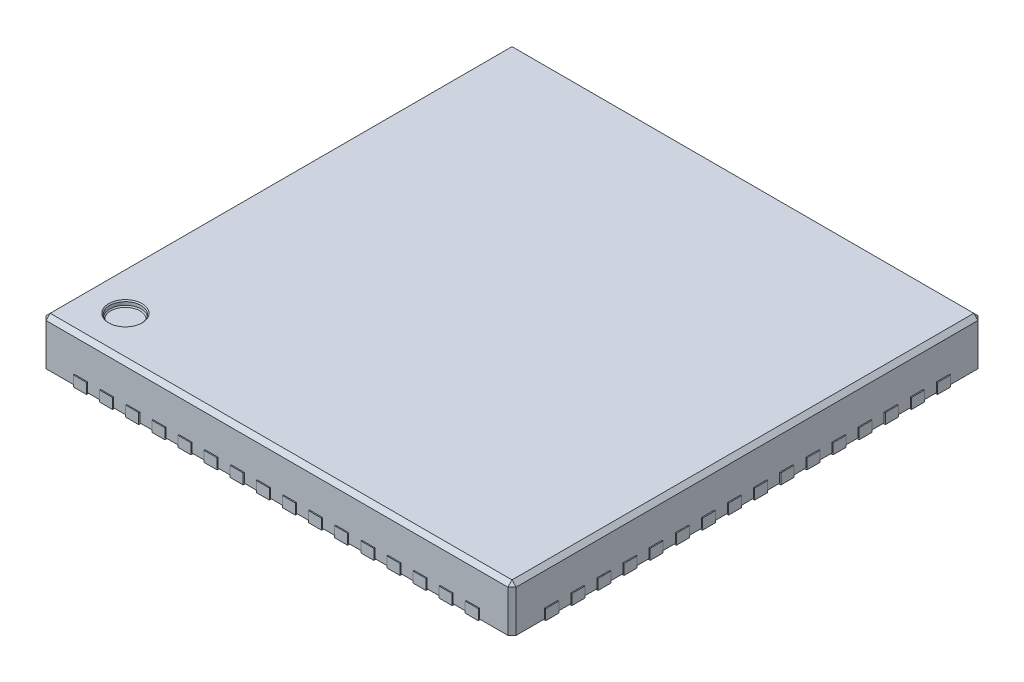
from build123d import *

# Parameters (mm, degrees)
BOSS_EXTRUDE1_DEPTH = 0.88
CHAMFER1_SIZE       = 0.08
SKETCH2_R           = 0.3
CUT_EXTRUDE1_DEPTH  = 0.1
CHAMFER2_SIZE       = 0.02
BOSS_EXTRUDE2_DEPTH = 0.2
LPATTERN1_COUNT     = 8
LPATTERN1_PITCH     = 0.5
LPATTERN2_COUNT     = 9
LPATTERN2_PITCH     = 0.5
CIRPATTERN2_COUNT   = 4
BOSS_EXTRUDE3_DEPTH = 0.2


with BuildPart() as part:
    # 3DSketch1 → Boss-Extrude1 (new body)
    with BuildSketch(Plane(origin=(-4.5, 0.02, 4.5), x_dir=(0.7071067811865474, 0, -0.7071067811865477), z_dir=(0, 1, 0))):
        Polygon((0, 0), (6.363961031, -6.363961031), (12.727922061, 0), (6.363961031, 6.363961031), align=None)
    extrude(amount=BOSS_EXTRUDE1_DEPTH)

    # Chamfer1
    chamfer1_edges = [part.edges().sort_by_distance(p)[0] for p in [
        (-4.5, 0.9, 0),
        (-4.5, 0.46, -4.5),
        (0, 0.9, -4.5),
        (4.5, 0.46, -4.5),
        (4.5, 0.9, 0),
        (-4.5, 0.46, 4.5),
        (0, 0.9, 4.5),
        (4.5, 0.46, 4.5),
    ]]
    chamfer(chamfer1_edges, length=CHAMFER1_SIZE)

    # Sketch2 → Cut-Extrude1 (cut)
    with BuildSketch(Plane(origin=(0, 0.9, 0), x_dir=(1, 0, 0), z_dir=(0, 1, 0))):
        with Locations((-3.7, -3.7)):
            Circle(SKETCH2_R)
    extrude(amount=-CUT_EXTRUDE1_DEPTH, mode=Mode.SUBTRACT)

    # Chamfer2
    chamfer2_edges = [part.edges().sort_by_distance(p)[0] for p in [
        (-4, 0.9, 3.7),
        (-4, 0.8, 3.7),
    ]]
    chamfer(chamfer2_edges, length=CHAMFER2_SIZE)


with BuildPart() as body_2:
    # Sketch3 → Boss-Extrude2 (new body)
    with BuildSketch(Plane(origin=(0, 0, 0), x_dir=(1, 0, 0), z_dir=(0, 1, 0))):
        with BuildLine():
            Line((0.375, 4.52), (0.125, 4.52))
            Line((0.125, 4.52), (0.125, 4.225))
            ThreePointArc((0.125, 4.225), (0.25, 4.1), (0.375, 4.225))
            Line((0.375, 4.225), (0.375, 4.52))
        make_face()
    extrude(amount=BOSS_EXTRUDE2_DEPTH)


with BuildPart() as lpattern1_1:
    # LPattern1: pattern copy
    add(body_2.part.moved(Location(Vector(1, 0, 0) * (1 * LPATTERN1_PITCH))))


with BuildPart() as lpattern1_2:
    # LPattern1: pattern copy
    add(body_2.part.moved(Location(Vector(1, 0, 0) * (2 * LPATTERN1_PITCH))))


with BuildPart() as lpattern1_3:
    # LPattern1: pattern copy
    add(body_2.part.moved(Location(Vector(1, 0, 0) * (3 * LPATTERN1_PITCH))))


with BuildPart() as lpattern1_4:
    # LPattern1: pattern copy
    add(body_2.part.moved(Location(Vector(1, 0, 0) * (4 * LPATTERN1_PITCH))))


with BuildPart() as lpattern1_5:
    # LPattern1: pattern copy
    add(body_2.part.moved(Location(Vector(1, 0, 0) * (5 * LPATTERN1_PITCH))))


with BuildPart() as lpattern1_6:
    # LPattern1: pattern copy
    add(body_2.part.moved(Location(Vector(1, 0, 0) * (6 * LPATTERN1_PITCH))))


with BuildPart() as lpattern1_7:
    # LPattern1: pattern copy
    add(body_2.part.moved(Location(Vector(1, 0, 0) * (7 * LPATTERN1_PITCH))))


with BuildPart() as lpattern2_1:
    # LPattern2: pattern copy
    add(body_2.part.moved(Location(Vector(-1, 0, 0) * (1 * LPATTERN2_PITCH))))


with BuildPart() as lpattern2_2:
    # LPattern2: pattern copy
    add(body_2.part.moved(Location(Vector(-1, 0, 0) * (2 * LPATTERN2_PITCH))))


with BuildPart() as lpattern2_3:
    # LPattern2: pattern copy
    add(body_2.part.moved(Location(Vector(-1, 0, 0) * (3 * LPATTERN2_PITCH))))


with BuildPart() as lpattern2_4:
    # LPattern2: pattern copy
    add(body_2.part.moved(Location(Vector(-1, 0, 0) * (4 * LPATTERN2_PITCH))))


with BuildPart() as lpattern2_5:
    # LPattern2: pattern copy
    add(body_2.part.moved(Location(Vector(-1, 0, 0) * (5 * LPATTERN2_PITCH))))


with BuildPart() as lpattern2_6:
    # LPattern2: pattern copy
    add(body_2.part.moved(Location(Vector(-1, 0, 0) * (6 * LPATTERN2_PITCH))))


with BuildPart() as lpattern2_7:
    # LPattern2: pattern copy
    add(body_2.part.moved(Location(Vector(-1, 0, 0) * (7 * LPATTERN2_PITCH))))


with BuildPart() as lpattern2_8:
    # LPattern2: pattern copy
    add(body_2.part.moved(Location(Vector(-1, 0, 0) * (8 * LPATTERN2_PITCH))))


with BuildPart() as cirpattern2_1:
    # CirPattern2: pattern copy
    add(lpattern1_7.part.rotate(Axis((0, 0, 0), (0, 1, 0)), 1 * 360 / CIRPATTERN2_COUNT))


with BuildPart() as cirpattern2_2:
    # CirPattern2: pattern copy
    add(lpattern1_7.part.rotate(Axis((0, 0, 0), (0, 1, 0)), 2 * 360 / CIRPATTERN2_COUNT))


with BuildPart() as cirpattern2_3:
    # CirPattern2: pattern copy
    add(lpattern1_7.part.rotate(Axis((0, 0, 0), (0, 1, 0)), 3 * 360 / CIRPATTERN2_COUNT))


with BuildPart() as cirpattern2_4:
    # CirPattern2: pattern copy
    add(lpattern1_6.part.rotate(Axis((0, 0, 0), (0, 1, 0)), 1 * 360 / CIRPATTERN2_COUNT))


with BuildPart() as cirpattern2_5:
    # CirPattern2: pattern copy
    add(lpattern1_6.part.rotate(Axis((0, 0, 0), (0, 1, 0)), 2 * 360 / CIRPATTERN2_COUNT))


with BuildPart() as cirpattern2_6:
    # CirPattern2: pattern copy
    add(lpattern1_6.part.rotate(Axis((0, 0, 0), (0, 1, 0)), 3 * 360 / CIRPATTERN2_COUNT))


with BuildPart() as cirpattern2_7:
    # CirPattern2: pattern copy
    add(lpattern1_5.part.rotate(Axis((0, 0, 0), (0, 1, 0)), 1 * 360 / CIRPATTERN2_COUNT))


with BuildPart() as cirpattern2_8:
    # CirPattern2: pattern copy
    add(lpattern1_5.part.rotate(Axis((0, 0, 0), (0, 1, 0)), 2 * 360 / CIRPATTERN2_COUNT))


with BuildPart() as cirpattern2_9:
    # CirPattern2: pattern copy
    add(lpattern1_5.part.rotate(Axis((0, 0, 0), (0, 1, 0)), 3 * 360 / CIRPATTERN2_COUNT))


with BuildPart() as cirpattern2_10:
    # CirPattern2: pattern copy
    add(lpattern1_4.part.rotate(Axis((0, 0, 0), (0, 1, 0)), 1 * 360 / CIRPATTERN2_COUNT))


with BuildPart() as cirpattern2_11:
    # CirPattern2: pattern copy
    add(lpattern1_4.part.rotate(Axis((0, 0, 0), (0, 1, 0)), 2 * 360 / CIRPATTERN2_COUNT))


with BuildPart() as cirpattern2_12:
    # CirPattern2: pattern copy
    add(lpattern1_4.part.rotate(Axis((0, 0, 0), (0, 1, 0)), 3 * 360 / CIRPATTERN2_COUNT))


with BuildPart() as cirpattern2_13:
    # CirPattern2: pattern copy
    add(lpattern1_3.part.rotate(Axis((0, 0, 0), (0, 1, 0)), 1 * 360 / CIRPATTERN2_COUNT))


with BuildPart() as cirpattern2_14:
    # CirPattern2: pattern copy
    add(lpattern1_3.part.rotate(Axis((0, 0, 0), (0, 1, 0)), 2 * 360 / CIRPATTERN2_COUNT))


with BuildPart() as cirpattern2_15:
    # CirPattern2: pattern copy
    add(lpattern1_3.part.rotate(Axis((0, 0, 0), (0, 1, 0)), 3 * 360 / CIRPATTERN2_COUNT))


with BuildPart() as cirpattern2_16:
    # CirPattern2: pattern copy
    add(lpattern1_2.part.rotate(Axis((0, 0, 0), (0, 1, 0)), 1 * 360 / CIRPATTERN2_COUNT))


with BuildPart() as cirpattern2_17:
    # CirPattern2: pattern copy
    add(lpattern1_2.part.rotate(Axis((0, 0, 0), (0, 1, 0)), 2 * 360 / CIRPATTERN2_COUNT))


with BuildPart() as cirpattern2_18:
    # CirPattern2: pattern copy
    add(lpattern1_2.part.rotate(Axis((0, 0, 0), (0, 1, 0)), 3 * 360 / CIRPATTERN2_COUNT))


with BuildPart() as cirpattern2_19:
    # CirPattern2: pattern copy
    add(lpattern1_1.part.rotate(Axis((0, 0, 0), (0, 1, 0)), 1 * 360 / CIRPATTERN2_COUNT))


with BuildPart() as cirpattern2_20:
    # CirPattern2: pattern copy
    add(lpattern1_1.part.rotate(Axis((0, 0, 0), (0, 1, 0)), 2 * 360 / CIRPATTERN2_COUNT))


with BuildPart() as cirpattern2_21:
    # CirPattern2: pattern copy
    add(lpattern1_1.part.rotate(Axis((0, 0, 0), (0, 1, 0)), 3 * 360 / CIRPATTERN2_COUNT))


with BuildPart() as cirpattern2_22:
    # CirPattern2: pattern copy
    add(body_2.part.rotate(Axis((0, 0, 0), (0, 1, 0)), 1 * 360 / CIRPATTERN2_COUNT))


with BuildPart() as cirpattern2_23:
    # CirPattern2: pattern copy
    add(body_2.part.rotate(Axis((0, 0, 0), (0, 1, 0)), 2 * 360 / CIRPATTERN2_COUNT))


with BuildPart() as cirpattern2_24:
    # CirPattern2: pattern copy
    add(body_2.part.rotate(Axis((0, 0, 0), (0, 1, 0)), 3 * 360 / CIRPATTERN2_COUNT))


with BuildPart() as cirpattern2_25:
    # CirPattern2: pattern copy
    add(lpattern2_1.part.rotate(Axis((0, 0, 0), (0, 1, 0)), 1 * 360 / CIRPATTERN2_COUNT))


with BuildPart() as cirpattern2_26:
    # CirPattern2: pattern copy
    add(lpattern2_1.part.rotate(Axis((0, 0, 0), (0, 1, 0)), 2 * 360 / CIRPATTERN2_COUNT))


with BuildPart() as cirpattern2_27:
    # CirPattern2: pattern copy
    add(lpattern2_1.part.rotate(Axis((0, 0, 0), (0, 1, 0)), 3 * 360 / CIRPATTERN2_COUNT))


with BuildPart() as cirpattern2_28:
    # CirPattern2: pattern copy
    add(lpattern2_2.part.rotate(Axis((0, 0, 0), (0, 1, 0)), 1 * 360 / CIRPATTERN2_COUNT))


with BuildPart() as cirpattern2_29:
    # CirPattern2: pattern copy
    add(lpattern2_2.part.rotate(Axis((0, 0, 0), (0, 1, 0)), 2 * 360 / CIRPATTERN2_COUNT))


with BuildPart() as cirpattern2_30:
    # CirPattern2: pattern copy
    add(lpattern2_2.part.rotate(Axis((0, 0, 0), (0, 1, 0)), 3 * 360 / CIRPATTERN2_COUNT))


with BuildPart() as cirpattern2_31:
    # CirPattern2: pattern copy
    add(lpattern2_3.part.rotate(Axis((0, 0, 0), (0, 1, 0)), 1 * 360 / CIRPATTERN2_COUNT))


with BuildPart() as cirpattern2_32:
    # CirPattern2: pattern copy
    add(lpattern2_3.part.rotate(Axis((0, 0, 0), (0, 1, 0)), 2 * 360 / CIRPATTERN2_COUNT))


with BuildPart() as cirpattern2_33:
    # CirPattern2: pattern copy
    add(lpattern2_3.part.rotate(Axis((0, 0, 0), (0, 1, 0)), 3 * 360 / CIRPATTERN2_COUNT))


with BuildPart() as cirpattern2_34:
    # CirPattern2: pattern copy
    add(lpattern2_4.part.rotate(Axis((0, 0, 0), (0, 1, 0)), 1 * 360 / CIRPATTERN2_COUNT))


with BuildPart() as cirpattern2_35:
    # CirPattern2: pattern copy
    add(lpattern2_4.part.rotate(Axis((0, 0, 0), (0, 1, 0)), 2 * 360 / CIRPATTERN2_COUNT))


with BuildPart() as cirpattern2_36:
    # CirPattern2: pattern copy
    add(lpattern2_4.part.rotate(Axis((0, 0, 0), (0, 1, 0)), 3 * 360 / CIRPATTERN2_COUNT))


with BuildPart() as cirpattern2_37:
    # CirPattern2: pattern copy
    add(lpattern2_5.part.rotate(Axis((0, 0, 0), (0, 1, 0)), 1 * 360 / CIRPATTERN2_COUNT))


with BuildPart() as cirpattern2_38:
    # CirPattern2: pattern copy
    add(lpattern2_5.part.rotate(Axis((0, 0, 0), (0, 1, 0)), 2 * 360 / CIRPATTERN2_COUNT))


with BuildPart() as cirpattern2_39:
    # CirPattern2: pattern copy
    add(lpattern2_5.part.rotate(Axis((0, 0, 0), (0, 1, 0)), 3 * 360 / CIRPATTERN2_COUNT))


with BuildPart() as cirpattern2_40:
    # CirPattern2: pattern copy
    add(lpattern2_6.part.rotate(Axis((0, 0, 0), (0, 1, 0)), 1 * 360 / CIRPATTERN2_COUNT))


with BuildPart() as cirpattern2_41:
    # CirPattern2: pattern copy
    add(lpattern2_6.part.rotate(Axis((0, 0, 0), (0, 1, 0)), 2 * 360 / CIRPATTERN2_COUNT))


with BuildPart() as cirpattern2_42:
    # CirPattern2: pattern copy
    add(lpattern2_6.part.rotate(Axis((0, 0, 0), (0, 1, 0)), 3 * 360 / CIRPATTERN2_COUNT))


with BuildPart() as cirpattern2_43:
    # CirPattern2: pattern copy
    add(lpattern2_7.part.rotate(Axis((0, 0, 0), (0, 1, 0)), 1 * 360 / CIRPATTERN2_COUNT))


with BuildPart() as cirpattern2_44:
    # CirPattern2: pattern copy
    add(lpattern2_7.part.rotate(Axis((0, 0, 0), (0, 1, 0)), 2 * 360 / CIRPATTERN2_COUNT))


with BuildPart() as cirpattern2_45:
    # CirPattern2: pattern copy
    add(lpattern2_7.part.rotate(Axis((0, 0, 0), (0, 1, 0)), 3 * 360 / CIRPATTERN2_COUNT))


with BuildPart() as cirpattern2_46:
    # CirPattern2: pattern copy
    add(lpattern2_8.part.rotate(Axis((0, 0, 0), (0, 1, 0)), 1 * 360 / CIRPATTERN2_COUNT))


with BuildPart() as cirpattern2_47:
    # CirPattern2: pattern copy
    add(lpattern2_8.part.rotate(Axis((0, 0, 0), (0, 1, 0)), 2 * 360 / CIRPATTERN2_COUNT))


with BuildPart() as cirpattern2_48:
    # CirPattern2: pattern copy
    add(lpattern2_8.part.rotate(Axis((0, 0, 0), (0, 1, 0)), 3 * 360 / CIRPATTERN2_COUNT))


with BuildPart() as body_66:
    # Sketch4 → Boss-Extrude3 (new body)
    with BuildSketch(Plane(origin=(0, 0, 0), x_dir=(1, 0, 0), z_dir=(0, 1, 0))):
        with BuildLine():
            Line((-3.178047264, -3.55), (3.45, -3.55))
            ThreePointArc((3.45, -3.55), (3.520710678, -3.520710678), (3.55, -3.45))
            Line((3.55, -3.45), (3.55, 3.45))
            ThreePointArc((3.55, 3.45), (3.520710678, 3.520710678), (3.45, 3.55))
            Line((3.45, 3.55), (-3.45, 3.55))
            ThreePointArc((-3.45, 3.55), (-3.520710678, 3.520710678), (-3.55, 3.45))
            Line((-3.55, 3.45), (-3.55, -3.178047264))
            ThreePointArc((-3.55, -3.178047264), (-3.544516836, -3.191804497), (-3.531073854, -3.198018414))
            ThreePointArc((-3.531073854, -3.198018414), (-3.300751895, -3.300751895), (-3.198018414, -3.531073854))
            ThreePointArc((-3.198018414, -3.531073854), (-3.191804497, -3.544516836), (-3.178047264, -3.55))
        make_face()
    extrude(amount=BOSS_EXTRUDE3_DEPTH)


solid = Compound([part.part, body_2.part, lpattern1_1.part, lpattern1_2.part, lpattern1_3.part, lpattern1_4.part, lpattern1_5.part, lpattern1_6.part, lpattern1_7.part, lpattern2_1.part, lpattern2_2.part, lpattern2_3.part, lpattern2_4.part, lpattern2_5.part, lpattern2_6.part, lpattern2_7.part, lpattern2_8.part, cirpattern2_1.part, cirpattern2_2.part, cirpattern2_3.part, cirpattern2_4.part, cirpattern2_5.part, cirpattern2_6.part, cirpattern2_7.part, cirpattern2_8.part, cirpattern2_9.part, cirpattern2_10.part, cirpattern2_11.part, cirpattern2_12.part, cirpattern2_13.part, cirpattern2_14.part, cirpattern2_15.part, cirpattern2_16.part, cirpattern2_17.part, cirpattern2_18.part, cirpattern2_19.part, cirpattern2_20.part, cirpattern2_21.part, cirpattern2_22.part, cirpattern2_23.part, cirpattern2_24.part, cirpattern2_25.part, cirpattern2_26.part, cirpattern2_27.part, cirpattern2_28.part, cirpattern2_29.part, cirpattern2_30.part, cirpattern2_31.part, cirpattern2_32.part, cirpattern2_33.part, cirpattern2_34.part, cirpattern2_35.part, cirpattern2_36.part, cirpattern2_37.part, cirpattern2_38.part, cirpattern2_39.part, cirpattern2_40.part, cirpattern2_41.part, cirpattern2_42.part, cirpattern2_43.part, cirpattern2_44.part, cirpattern2_45.part, cirpattern2_46.part, cirpattern2_47.part, cirpattern2_48.part, body_66.part])
